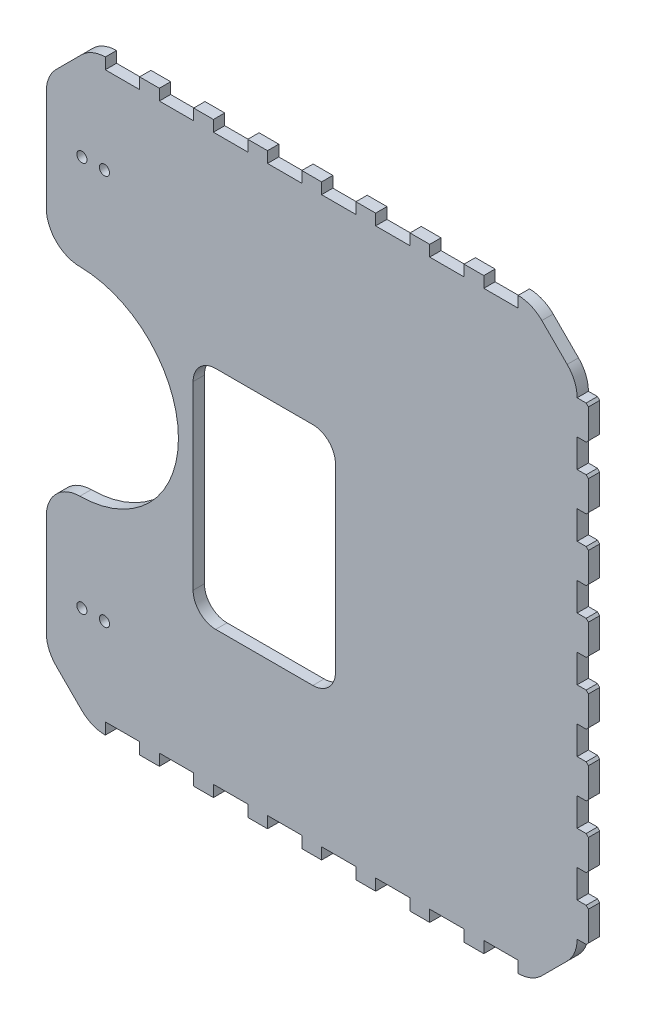
from build123d import *

# Parameters (mm, degrees)
ESQUISSE1_W                            = 235
ESQUISSE1_H                            = 260
BOSS_EXTRU_1_DEPTH                     = 5
ENL_V_MAT_EXTRU_1_DEPTH                = 351.499643366
CHANFREIN1_SIZE                        = 20
CONG_1_R                               = 15
CHANFREIN2_SIZE                        = 20
CONG_2_R                               = 15
ENL_V_MAT_EXTRU_2_DEPTH                = 351.499643366
CHANFREIN3_SIZE                        = 20
CHANFREIN4_SIZE                        = 20
CONG_3_R                               = 15
BOSS_EXTRU_3_DEPTH                     = 5
TENON_ET_MORTAISE_TENON1_DEPTH         = 5
TENON_START                            = -260
TENON_ET_MORTAISE_RAINURE1_OUTLINE_W   = 15.2
TENON_ET_MORTAISE_RAINURE1_OUTLINE_H   = 5
TENON_ET_MORTAISE_RAINURE1_DEPTH       = 5.1
TENON_START_2                          = -208.886796564
TENON_ET_MORTAISE_RAINURE2_OUTLINE_W   = 4.9
TENON_ET_MORTAISE_RAINURE2_OUTLINE_H   = 5
TENON_ET_MORTAISE_RAINURE2_DEPTH       = 15.2
TENON_START_3                          = -184.947711832
TENON_ET_MORTAISE_RAINURE2_2_OUTLINE_W = 4.9
TENON_ET_MORTAISE_RAINURE2_2_OUTLINE_H = 5
TENON_ET_MORTAISE_RAINURE2_2_DEPTH     = 15.2
TENON_START_4                          = -161.008627099
TENON_ET_MORTAISE_RAINURE2_3_OUTLINE_W = 4.9
TENON_ET_MORTAISE_RAINURE2_3_OUTLINE_H = 5
TENON_ET_MORTAISE_RAINURE2_3_DEPTH     = 15.2
TENON_START_5                          = -137.069542366
TENON_ET_MORTAISE_RAINURE2_4_OUTLINE_W = 4.9
TENON_ET_MORTAISE_RAINURE2_4_OUTLINE_H = 5
TENON_ET_MORTAISE_RAINURE2_4_DEPTH     = 15.2
TENON_START_6                          = -113.130457634
TENON_ET_MORTAISE_RAINURE2_5_OUTLINE_W = 4.9
TENON_ET_MORTAISE_RAINURE2_5_OUTLINE_H = 5
TENON_ET_MORTAISE_RAINURE2_5_DEPTH     = 15.2
TENON_START_7                          = -89.191372901
TENON_ET_MORTAISE_RAINURE2_6_OUTLINE_W = 4.9
TENON_ET_MORTAISE_RAINURE2_6_OUTLINE_H = 5
TENON_ET_MORTAISE_RAINURE2_6_DEPTH     = 15.2
TENON_START_8                          = -65.252288168
TENON_ET_MORTAISE_RAINURE2_7_OUTLINE_W = 4.9
TENON_ET_MORTAISE_RAINURE2_7_OUTLINE_H = 5
TENON_ET_MORTAISE_RAINURE2_7_DEPTH     = 15.2
TENON_START_9                          = -41.313203436
TENON_ET_MORTAISE_RAINURE2_8_OUTLINE_W = 4.9
TENON_ET_MORTAISE_RAINURE2_8_OUTLINE_H = 5
TENON_ET_MORTAISE_RAINURE2_8_DEPTH     = 15.2
ESQUISSE6_R                            = 2.25
ENL_V_MAT_EXTRU_3_DEPTH                = 351.499643366


# Read off the part's stored shape, not the designer's step: Tenon et mortaise-Tenon1, Tenon et mortaise-Rainure1, Tenon et mortaise-Rainure2
with BuildPart() as part:
    # Esquisse1 → Boss.-Extru.1 (new body)
    with BuildSketch(Plane.XY):
        with Locations((-117.5, -130)):
            Rectangle(ESQUISSE1_W, ESQUISSE1_H)
    extrude(amount=BOSS_EXTRU_1_DEPTH)

    # Esquisse2 → Enlèv. mat.-Extru.1 (cut, through all)
    with BuildSketch(Plane.XY.offset(5)):
        with BuildLine():
            Line((-235, -88.457244293), (-235, -171.541538838))
            ThreePointArc((-235, -171.541538838), (-176.5, -129.999391565), (-235, -88.457244293))
        make_face()
    extrude(amount=-ENL_V_MAT_EXTRU_1_DEPTH, mode=Mode.SUBTRACT)

    # Chanfrein1
    chanfrein1_edges = [part.edges().sort_by_distance(p)[0] for p in [
        (-235, -260, 2.5),
    ]]
    chamfer(chanfrein1_edges, length=CHANFREIN1_SIZE)

    # Congé1
    cong_1_edges = [part.edges().sort_by_distance(p)[0] for p in [
        (-215, -260, 2.5),
        (-235, -240, 2.5),
    ]]
    fillet(cong_1_edges, radius=CONG_1_R)

    # Chanfrein2
    chanfrein2_edges = [part.edges().sort_by_distance(p)[0] for p in [
        (-235, 0, 2.5),
    ]]
    chamfer(chanfrein2_edges, length=CHANFREIN2_SIZE)

    # Congé2
    cong_2_edges = [part.edges().sort_by_distance(p)[0] for p in [
        (-235, -20, 2.5),
        (-215, 0, 2.5),
    ]]
    fillet(cong_2_edges, radius=CONG_2_R)

    # Esquisse4 → Enlèv. mat.-Extru.2 (cut, through all)
    with BuildSketch(Plane(origin=(0, 0, 0), x_dir=(-1, 0, 0), z_dir=(0, 0, -1))):
        with BuildLine():
            Line((20, -195), (160, -195))
            ThreePointArc((160, -195), (167.071067812, -192.071067812), (170, -185))
            Line((170, -185), (170, -105))
            ThreePointArc((170, -105), (167.071067812, -97.928932188), (160, -95))
            Line((160, -95), (60, -95))
            ThreePointArc((60, -95), (52.928932188, -97.928932188), (50, -105))
            Line((50, -105), (50, -135))
            ThreePointArc((50, -135), (47.071067812, -142.071067812), (40, -145))
            Line((40, -145), (20, -145))
            ThreePointArc((20, -145), (12.928932188, -147.928932188), (10, -155))
            Line((10, -155), (10, -185))
            ThreePointArc((10, -185), (12.928932188, -192.071067812), (20, -195))
        make_face()
    extrude(amount=-ENL_V_MAT_EXTRU_2_DEPTH, mode=Mode.SUBTRACT)

    # Chanfrein3
    chanfrein3_edges = [part.edges().sort_by_distance(p)[0] for p in [
        (0, -260, 2.5),
    ]]
    chamfer(chanfrein3_edges, length=CHANFREIN3_SIZE)

    # Chanfrein4
    chanfrein4_edges = [part.edges().sort_by_distance(p)[0] for p in [
        (0, 0, 2.5),
    ]]
    chamfer(chanfrein4_edges, length=CHANFREIN4_SIZE)

    # Congé3
    cong_3_edges = [part.edges().sort_by_distance(p)[0] for p in [
        (0, -240, 2.5),
        (-20, -260, 2.5),
        (-20, 0, 2.5),
        (0, -20, 2.5),
        (-235, -171.541538838, 2.5),
        (-235, -88.457244293, 2.5),
    ]]
    fillet(cong_3_edges, radius=CONG_3_R)

    # Esquisse5 → Boss.-Extru.3 (add, through all)
    with BuildSketch(Plane(origin=(0, 0, 0), x_dir=(-1, 0, 0), z_dir=(0, 0, -1))):
        with BuildLine():
            ThreePointArc((117, -195), (109.928932188, -192.071067812), (107, -185))
            Line((107, -185), (107, -105))
            ThreePointArc((107, -105), (109.928932188, -97.928932188), (117, -95))
            Line((117, -95), (60, -95))
            ThreePointArc((60, -95), (52.928932188, -97.928932188), (50, -105))
            Line((50, -105), (50, -135))
            ThreePointArc((50, -135), (47.071067812, -142.071067812), (40, -145))
            Line((40, -145), (20, -145))
            ThreePointArc((20, -145), (12.928932188, -147.928932188), (10, -155))
            Line((10, -155), (10, -185))
            ThreePointArc((10, -185), (12.928932188, -192.071067812), (20, -195))
            Line((20, -195), (117, -195))
        make_face()
    extrude(amount=-BOSS_EXTRU_3_DEPTH)

    # Tenon et mortaise-Tenon1 outline → Tenon et mortaise-Tenon1 (add)
    with BuildSketch(Plane.XY):
        Polygon((0, -26.213203436), (0, -41.213203436), (4, -41.213203436), (5, -40.213203436), (5, -27.213203436), (4, -26.213203436), align=None)
        Polygon((0, -53.72371674), (0, -68.72371674), (4, -68.72371674), (5, -67.72371674), (5, -54.72371674), (4, -53.72371674), align=None)
        Polygon((0, -81.234230044), (0, -96.234230044), (4, -96.234230044), (5, -95.234230044), (5, -82.234230044), (4, -81.234230044), align=None)
        Polygon((0, -108.744743348), (0, -123.744743348), (4, -123.744743348), (5, -122.744743348), (5, -109.744743348), (4, -108.744743348), align=None)
        Polygon((0, -136.255256652), (0, -151.255256652), (4, -151.255256652), (5, -150.255256652), (5, -137.255256652), (4, -136.255256652), align=None)
        Polygon((0, -163.765769956), (0, -178.765769956), (4, -178.765769956), (5, -177.765769956), (5, -164.765769956), (4, -163.765769956), align=None)
        Polygon((0, -191.27628326), (0, -206.27628326), (4, -206.27628326), (5, -205.27628326), (5, -192.27628326), (4, -191.27628326), align=None)
        Polygon((4, -218.786796564), (0, -218.786796564), (0, -233.786796564), (4, -233.786796564), (5, -232.786796564), (5, -219.786796564), align=None)
    extrude(amount=TENON_ET_MORTAISE_TENON1_DEPTH)

    # Tenon et mortaise-Rainure1 outline → Tenon et mortaise-Rainure1 (cut)
    with BuildSketch(Plane(origin=(0, 0, 0), x_dir=(1, 0, 0), z_dir=(0, 1, 0)).offset(TENON_START)):
        with Locations((-33.713203436, -2.5)):
            Rectangle(TENON_ET_MORTAISE_RAINURE1_OUTLINE_W, TENON_ET_MORTAISE_RAINURE1_OUTLINE_H)
        with Locations((-57.652288168, -2.5)):
            Rectangle(TENON_ET_MORTAISE_RAINURE1_OUTLINE_W, TENON_ET_MORTAISE_RAINURE1_OUTLINE_H)
        with Locations((-81.591372901, -2.5)):
            Rectangle(TENON_ET_MORTAISE_RAINURE1_OUTLINE_W, TENON_ET_MORTAISE_RAINURE1_OUTLINE_H)
        with Locations((-105.530457634, -2.5)):
            Rectangle(TENON_ET_MORTAISE_RAINURE1_OUTLINE_W, TENON_ET_MORTAISE_RAINURE1_OUTLINE_H)
        with Locations((-129.469542366, -2.5)):
            Rectangle(TENON_ET_MORTAISE_RAINURE1_OUTLINE_W, TENON_ET_MORTAISE_RAINURE1_OUTLINE_H)
        with Locations((-153.408627099, -2.5)):
            Rectangle(TENON_ET_MORTAISE_RAINURE1_OUTLINE_W, TENON_ET_MORTAISE_RAINURE1_OUTLINE_H)
        with Locations((-177.347711832, -2.5)):
            Rectangle(TENON_ET_MORTAISE_RAINURE1_OUTLINE_W, TENON_ET_MORTAISE_RAINURE1_OUTLINE_H)
        with Locations((-201.286796564, -2.5)):
            Rectangle(TENON_ET_MORTAISE_RAINURE1_OUTLINE_W, TENON_ET_MORTAISE_RAINURE1_OUTLINE_H)
    extrude(amount=TENON_ET_MORTAISE_RAINURE1_DEPTH, mode=Mode.SUBTRACT)

    # Tenon et mortaise-Rainure2 outline → Tenon et mortaise-Rainure2 (cut)
    with BuildSketch(Plane.YZ.offset(TENON_START_2)):
        with Locations((-2.45, 2.5)):
            Rectangle(TENON_ET_MORTAISE_RAINURE2_OUTLINE_W, TENON_ET_MORTAISE_RAINURE2_OUTLINE_H)
    extrude(amount=TENON_ET_MORTAISE_RAINURE2_DEPTH, mode=Mode.SUBTRACT)

    # Tenon et mortaise-Rainure2 2 outline → Tenon et mortaise-Rainure2 2 (cut)
    with BuildSketch(Plane.YZ.offset(TENON_START_3)):
        with Locations((-2.45, 2.5)):
            Rectangle(TENON_ET_MORTAISE_RAINURE2_2_OUTLINE_W, TENON_ET_MORTAISE_RAINURE2_2_OUTLINE_H)
    extrude(amount=TENON_ET_MORTAISE_RAINURE2_2_DEPTH, mode=Mode.SUBTRACT)

    # Tenon et mortaise-Rainure2 3 outline → Tenon et mortaise-Rainure2 3 (cut)
    with BuildSketch(Plane.YZ.offset(TENON_START_4)):
        with Locations((-2.45, 2.5)):
            Rectangle(TENON_ET_MORTAISE_RAINURE2_3_OUTLINE_W, TENON_ET_MORTAISE_RAINURE2_3_OUTLINE_H)
    extrude(amount=TENON_ET_MORTAISE_RAINURE2_3_DEPTH, mode=Mode.SUBTRACT)

    # Tenon et mortaise-Rainure2 4 outline → Tenon et mortaise-Rainure2 4 (cut)
    with BuildSketch(Plane.YZ.offset(TENON_START_5)):
        with Locations((-2.45, 2.5)):
            Rectangle(TENON_ET_MORTAISE_RAINURE2_4_OUTLINE_W, TENON_ET_MORTAISE_RAINURE2_4_OUTLINE_H)
    extrude(amount=TENON_ET_MORTAISE_RAINURE2_4_DEPTH, mode=Mode.SUBTRACT)

    # Tenon et mortaise-Rainure2 5 outline → Tenon et mortaise-Rainure2 5 (cut)
    with BuildSketch(Plane.YZ.offset(TENON_START_6)):
        with Locations((-2.45, 2.5)):
            Rectangle(TENON_ET_MORTAISE_RAINURE2_5_OUTLINE_W, TENON_ET_MORTAISE_RAINURE2_5_OUTLINE_H)
    extrude(amount=TENON_ET_MORTAISE_RAINURE2_5_DEPTH, mode=Mode.SUBTRACT)

    # Tenon et mortaise-Rainure2 6 outline → Tenon et mortaise-Rainure2 6 (cut)
    with BuildSketch(Plane.YZ.offset(TENON_START_7)):
        with Locations((-2.45, 2.5)):
            Rectangle(TENON_ET_MORTAISE_RAINURE2_6_OUTLINE_W, TENON_ET_MORTAISE_RAINURE2_6_OUTLINE_H)
    extrude(amount=TENON_ET_MORTAISE_RAINURE2_6_DEPTH, mode=Mode.SUBTRACT)

    # Tenon et mortaise-Rainure2 7 outline → Tenon et mortaise-Rainure2 7 (cut)
    with BuildSketch(Plane.YZ.offset(TENON_START_8)):
        with Locations((-2.45, 2.5)):
            Rectangle(TENON_ET_MORTAISE_RAINURE2_7_OUTLINE_W, TENON_ET_MORTAISE_RAINURE2_7_OUTLINE_H)
    extrude(amount=TENON_ET_MORTAISE_RAINURE2_7_DEPTH, mode=Mode.SUBTRACT)

    # Tenon et mortaise-Rainure2 8 outline → Tenon et mortaise-Rainure2 8 (cut)
    with BuildSketch(Plane.YZ.offset(TENON_START_9)):
        with Locations((-2.45, 2.5)):
            Rectangle(TENON_ET_MORTAISE_RAINURE2_8_OUTLINE_W, TENON_ET_MORTAISE_RAINURE2_8_OUTLINE_H)
    extrude(amount=TENON_ET_MORTAISE_RAINURE2_8_DEPTH, mode=Mode.SUBTRACT)

    # Esquisse6 → Enlèv. mat.-Extru.3 (cut, through all)
    with BuildSketch(Plane.XY.offset(5)):
        with Locations((-209.25, -43.5)):
            Circle(ESQUISSE6_R)
        with Locations((-219.25, -43.5)):
            Circle(ESQUISSE6_R)
    enl_v_mat_extru_3 = extrude(amount=-ENL_V_MAT_EXTRU_3_DEPTH, mode=Mode.SUBTRACT)

    # Symétrie1: Enlèv. mat.-Extru.3 across plane
    add(enl_v_mat_extru_3.mirror(Plane.ZX.offset(-130)), mode=Mode.SUBTRACT)


solid = part.part
